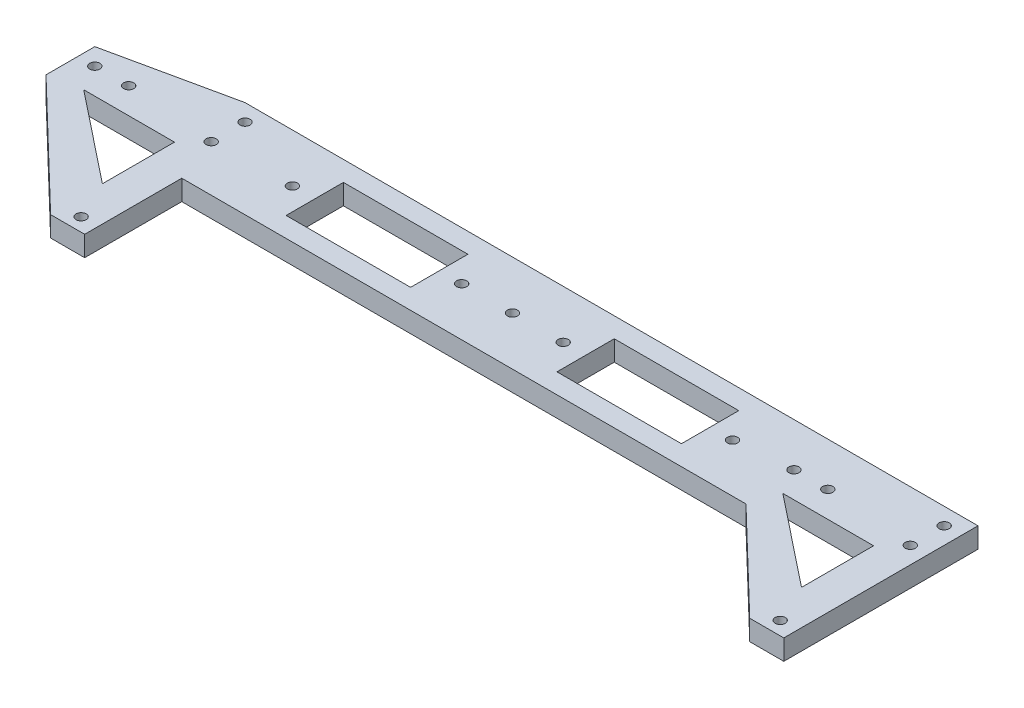
from build123d import *

# Parameters (mm, degrees)
SKETCH1_R           = 1.5
BOSS_EXTRUDE1_DEPTH = 3
SKETCH4_R           = 1.5
CUT_EXTRUDE2_DEPTH  = 7
SKETCH5_W           = 46.5
SKETCH5_H           = 2
CUT_EXTRUDE3_DEPTH  = 7
CUT_EXTRUDE4_DEPTH  = 7
CUT_EXTRUDE5_DEPTH  = 7
BOSS_EXTRUDE2_START = -6
SKETCH8_R           = 1.5
BOSS_EXTRUDE2_DEPTH = 6
SKETCH9_R           = 1.5
CUT_EXTRUDE6_DEPTH  = 6
SKETCH10_R          = 1.5
CUT_EXTRUDE7_DEPTH  = 6
SKETCH11_W          = 36.769244088
SKETCH11_H          = 16.925373541
CUT_EXTRUDE8_DEPTH  = 14


with BuildPart() as part:
    # Sketch1 → Boss-Extrude1 (new body)
    with BuildSketch(Plane(origin=(0, 0, 0), x_dir=(1, 0, 0), z_dir=(0, 1, 0))):
        Polygon((41.5, 64.6), (31.5, 64.6), (-5, 56.73), (-5, 5.234024539), (41.5, 5.234024539), align=None)
        with Locations((0, 10.18)):
            Circle(SKETCH1_R, mode=Mode.SUBTRACT)
        with Locations((36.5, 11.18)):
            Circle(SKETCH1_R, mode=Mode.SUBTRACT)
        with Locations((0, 51.73)):
            Circle(SKETCH1_R, mode=Mode.SUBTRACT)
        with Locations((36.5, 49.6)):
            Circle(SKETCH1_R, mode=Mode.SUBTRACT)
        with Locations((36.5, 59.6)):
            Circle(SKETCH1_R, mode=Mode.SUBTRACT)
    extrude(amount=BOSS_EXTRUDE1_DEPTH)

    # Sketch4 → Cut-Extrude2 (cut)
    with BuildSketch(Plane(origin=(0, 3, 0), x_dir=(1, 0, 0), z_dir=(0, 1, 0))):
        with Locations((10, 51.73)):
            Circle(SKETCH4_R)
    extrude(amount=-CUT_EXTRUDE2_DEPTH, mode=Mode.SUBTRACT)

    # Sketch5 → Cut-Extrude3 (cut)
    with BuildSketch(Plane(origin=(0, 3, 0), x_dir=(1, 0, 0), z_dir=(0, 1, 0))):
        with Locations((18.25, 6.234024539)):
            Rectangle(SKETCH5_W, SKETCH5_H)
    extrude(amount=-CUT_EXTRUDE3_DEPTH, mode=Mode.SUBTRACT)

    # Sketch6 → Cut-Extrude4 (cut)
    with BuildSketch(Plane(origin=(0, 3, 0), x_dir=(1, 0, 0), z_dir=(0, 1, 0))):
        Polygon((31.443621834, 7.234024539), (-5, 42.312799573), (-5, 7.234024539), align=None)
    extrude(amount=-CUT_EXTRUDE4_DEPTH, mode=Mode.SUBTRACT)

    # Sketch7 → Cut-Extrude5 (cut)
    with BuildSketch(Plane(origin=(0, 3, 0), x_dir=(1, 0, 0), z_dir=(0, 1, 0))):
        Polygon((31.193110027, 22.772878628), (31.193110027, 44.066382221), (4.388346681, 44.066382221), align=None)
    extrude(amount=-CUT_EXTRUDE5_DEPTH, mode=Mode.SUBTRACT)

    # Sketch8 → Boss-Extrude2 (add)
    with BuildSketch(Plane(origin=(0, 3, 0), x_dir=(1, 0, 0), z_dir=(0, 1, 0)).offset(BOSS_EXTRUDE2_START)):
        Polygon((41.5, 7.234024539), (41.5, 35.917012269), (208.144634928, 35.917012269), (237.943621834, 7.234024539), (248, 7.234024539), (248, 64.6), (31.5, 64.6), (-5, 56.73), (-5, 42.312799573), (31.443621834, 7.234024539), align=None)
        with Locations((36.5, 11.18)):
            Circle(SKETCH8_R, mode=Mode.SUBTRACT)
        Polygon((31.193110027, 22.772878628), (4.388346681, 44.066382221), (31.193110027, 44.066382221), align=None, mode=Mode.SUBTRACT)
        with Locations((36.5, 49.6)):
            Circle(SKETCH8_R, mode=Mode.SUBTRACT)
        with Locations((0, 51.73)):
            Circle(SKETCH8_R, mode=Mode.SUBTRACT)
        with Locations((10, 51.73)):
            Circle(SKETCH8_R, mode=Mode.SUBTRACT)
        with Locations((36.5, 59.6)):
            Circle(SKETCH8_R, mode=Mode.SUBTRACT)
        with Locations((206.5, 51.73)):
            Circle(SKETCH8_R, mode=Mode.SUBTRACT)
        with Locations((216.5, 51.73)):
            Circle(SKETCH8_R, mode=Mode.SUBTRACT)
        with Locations((243, 59.6)):
            Circle(SKETCH8_R, mode=Mode.SUBTRACT)
        with Locations((243, 11.18)):
            Circle(SKETCH8_R, mode=Mode.SUBTRACT)
        Polygon((237.693110027, 22.772878628), (210.888346681, 44.066382221), (237.693110027, 44.066382221), align=None, mode=Mode.SUBTRACT)
        with Locations((243, 49.6)):
            Circle(SKETCH8_R, mode=Mode.SUBTRACT)
    extrude(amount=BOSS_EXTRUDE2_DEPTH)

    # Sketch9 → Cut-Extrude6 (cut)
    with BuildSketch(Plane(origin=(0, 3, 0), x_dir=(1, 0, 0), z_dir=(0, 1, 0))):
        with Locations((59.822317464, 50.258506135)):
            Circle(SKETCH9_R)
        with Locations((189.822317464, 50.258506135)):
            Circle(SKETCH9_R)
        with Locations((124.822317464, 50.258506135)):
            Circle(SKETCH9_R)
    extrude(amount=-CUT_EXTRUDE6_DEPTH, mode=Mode.SUBTRACT)

    # Sketch10 → Cut-Extrude7 (cut)
    with BuildSketch(Plane(origin=(0, 3, 0), x_dir=(1, 0, 0), z_dir=(0, 1, 0))):
        with Locations((124.822317464, 50.258506135)):
            Circle(SKETCH10_R)
        with Locations((109.822317464, 50.258506135)):
            Circle(SKETCH10_R)
        with Locations((139.822317464, 50.258506135)):
            Circle(SKETCH10_R)
    extrude(amount=-CUT_EXTRUDE7_DEPTH, mode=Mode.SUBTRACT)

    # Sketch11 → Cut-Extrude8 (cut)
    with BuildSketch(Plane(origin=(0, 3, 0), x_dir=(1, 0, 0), z_dir=(0, 1, 0))):
        with Locations((84.822317464, 50.258506135)):
            Rectangle(SKETCH11_W, SKETCH11_H)
        with Locations((164.822317464, 50.258506135)):
            Rectangle(SKETCH11_W, SKETCH11_H)
    extrude(amount=-CUT_EXTRUDE8_DEPTH, mode=Mode.SUBTRACT)


solid = part.part
